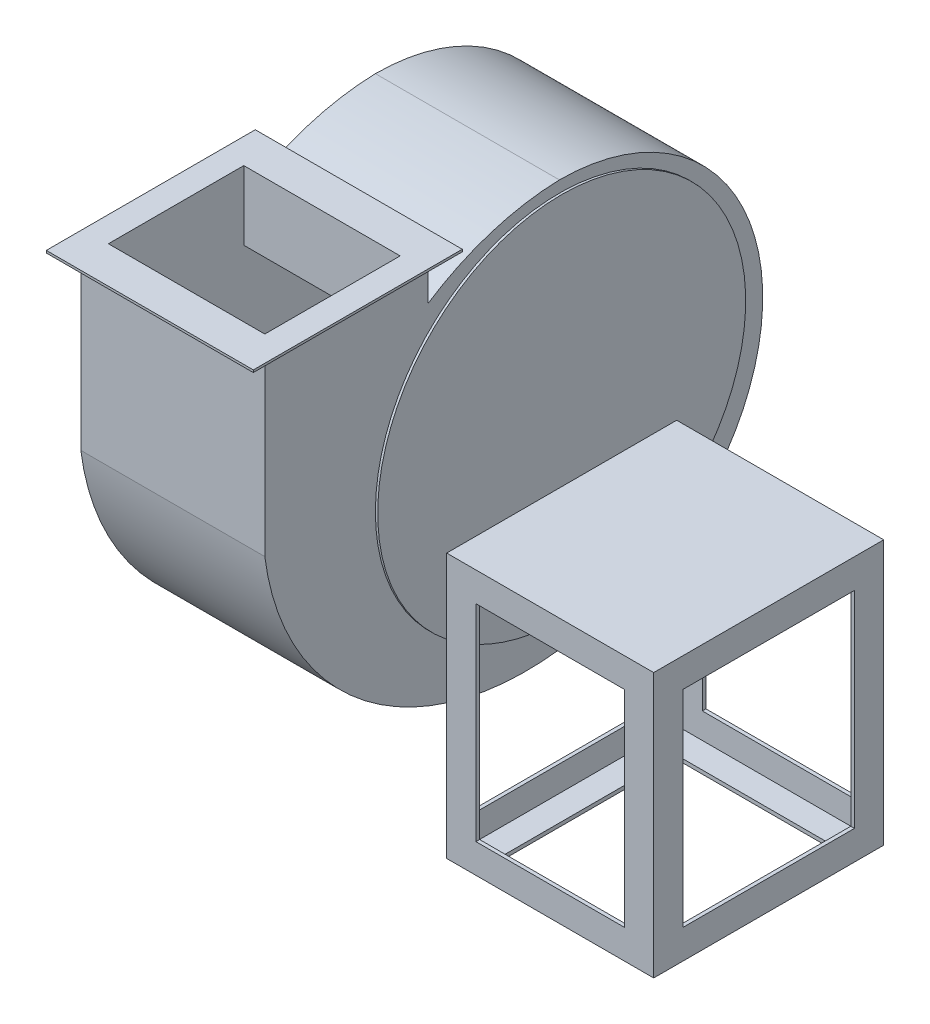
from build123d import *

# Parameters (mm, degrees)
SALIENTE_EXTRUIR1_DEPTH   = 230
SALIENTE_EXTRUIR1_2_DEPTH = 230
SALIENTE_EXTRUIR1_3_DEPTH = 230
SALIENTE_EXTRUIR1_4_DEPTH = 230
SALIENTE_EXTRUIR2_REACH   = 355.977
SALIENTE_EXTRUIR3_DEPTH   = 180
CROQUIS4_W                = 149.2
CROQUIS4_H                = 3.175
SALIENTE_EXTRUIR4_DEPTH   = 154.6
CROQUIS5_R                = 160
SALIENTE_EXTRUIR5_DEPTH   = 2
SALIENTE_EXTRUIR6_DEPTH   = 160
CROQUIS7_W                = 180
CROQUIS7_H                = 181.710341205
SALIENTE_EXTRUIR7_DEPTH   = 2
VACIADO1_START            = -150
VACIADO1_DEPTH            = 136
VACIADO1_START_2          = -14
VACIADO1_2_OUTLINE_R      = 148
VACIADO1_2_DEPTH          = 2
VACIADO1_START_3          = -12
VACIADO1_3_DEPTH          = 3.175
CROQUIS8_R                = 50
CORTAR_EXTRUIR1_DEPTH     = 14


# Read off the part's stored shape, not the designer's step: Vaciado1
with BuildPart() as part:
    # Croquis1 → Saliente-Extruir1 (new body)
    with BuildSketch(Plane(origin=(0, 0, 0), x_dir=(1, 0, 0), z_dir=(0, 1, 0))):
        Polygon((0, 0), (25.4, 0), (25.4, -3.175), (3.175, -3.175), (3.175, -25.4), (0, -25.4), align=None)
    extrude(amount=SALIENTE_EXTRUIR1_DEPTH)

    # Saliente-Extruir2: up to this face of the body (flat: up to its plane)
    saliente_extruir2_end = Plane(part.part.faces().sort_by_distance((12.7, 115, 0))[0])
    # Croquis2 → Saliente-Extruir2 (add, up to the picked face)
    with BuildSketch(Plane.XY.offset(200), mode=Mode.PRIVATE) as saliente_extruir2_sk1:
        Polygon((25.4, 230), (0, 230), (0, 204.6), (3.175, 204.6), (3.175, 226.825), (25.4, 226.825), align=None)
    saliente_extruir2_tool1 = split(extrude(saliente_extruir2_sk1.sketch, amount=-SALIENTE_EXTRUIR2_REACH, mode=Mode.PRIVATE), bisect_by=saliente_extruir2_end, keep=Keep.BOTH, mode=Mode.PRIVATE)
    # Croquis2 → Saliente-Extruir2 (add, up to the picked face)
    with BuildSketch(Plane.XY.offset(200), mode=Mode.PRIVATE) as saliente_extruir2_sk2:
        Polygon((176.825, 204.6), (180, 204.6), (180, 230), (154.6, 230), (154.6, 226.825), (176.825, 226.825), align=None)
    saliente_extruir2_tool2 = split(extrude(saliente_extruir2_sk2.sketch, amount=-SALIENTE_EXTRUIR2_REACH, mode=Mode.PRIVATE), bisect_by=saliente_extruir2_end, keep=Keep.BOTH, mode=Mode.PRIVATE)
    # Croquis2 → Saliente-Extruir2 (add, up to the picked face)
    with BuildSketch(Plane.XY.offset(200), mode=Mode.PRIVATE) as saliente_extruir2_sk3:
        Polygon((154.6, 0), (180, 0), (180, 25.4), (176.825, 25.4), (176.825, 3.175), (154.6, 3.175), align=None)
    saliente_extruir2_tool3 = split(extrude(saliente_extruir2_sk3.sketch, amount=-SALIENTE_EXTRUIR2_REACH, mode=Mode.PRIVATE), bisect_by=saliente_extruir2_end, keep=Keep.BOTH, mode=Mode.PRIVATE)
    # Croquis2 → Saliente-Extruir2 (add, up to the picked face)
    with BuildSketch(Plane.XY.offset(200), mode=Mode.PRIVATE) as saliente_extruir2_sk4:
        Polygon((3.175, 25.4), (0, 25.4), (0, 0), (25.4, 0), (25.4, 3.175), (3.175, 3.175), align=None)
    saliente_extruir2_tool4 = split(extrude(saliente_extruir2_sk4.sketch, amount=-SALIENTE_EXTRUIR2_REACH, mode=Mode.PRIVATE), bisect_by=saliente_extruir2_end, keep=Keep.BOTH, mode=Mode.PRIVATE)


with BuildPart() as body_2:
    # Croquis1 → Saliente-Extruir1 2 (new body)
    with BuildSketch(Plane(origin=(0, 0, 0), x_dir=(1, 0, 0), z_dir=(0, 1, 0))):
        Polygon((176.825, -25.4), (180, -25.4), (180, 0), (154.6, 0), (154.6, -3.175), (176.825, -3.175), align=None)
    extrude(amount=SALIENTE_EXTRUIR1_2_DEPTH)


with BuildPart() as body_3:
    # Croquis1 → Saliente-Extruir1 3 (new body)
    with BuildSketch(Plane(origin=(0, 0, 0), x_dir=(1, 0, 0), z_dir=(0, 1, 0))):
        Polygon((180, -200), (154.6, -200), (154.6, -196.825), (176.825, -196.825), (176.825, -174.6), (180, -174.6), align=None)
    extrude(amount=SALIENTE_EXTRUIR1_3_DEPTH)


with BuildPart() as body_4:
    # Croquis1 → Saliente-Extruir1 4 (new body)
    with BuildSketch(Plane(origin=(0, 0, 0), x_dir=(1, 0, 0), z_dir=(0, 1, 0))):
        Polygon((3.175, -174.6), (0, -174.6), (0, -200), (25.4, -200), (25.4, -196.825), (3.175, -196.825), align=None)
    extrude(amount=SALIENTE_EXTRUIR1_4_DEPTH)


with BuildPart() as part_1:
    add(part.part)

    add(body_2.part)  # Saliente-Extruir2 merges body 2

    add(body_3.part)  # Saliente-Extruir2 merges body 3

    add(body_4.part)  # Saliente-Extruir2 merges body 4
    add(saliente_extruir2_tool1.solids().sort_by(Axis((12.7, 229.64079, 200), (0, 0, -1)))[0])
    add(saliente_extruir2_tool2.solids().sort_by(Axis((178.4125, 204.95921, 200), (0, 0, -1)))[0])
    add(saliente_extruir2_tool3.solids().sort_by(Axis((167.3, 0.35921, 200), (0, 0, -1)))[0])
    add(saliente_extruir2_tool4.solids().sort_by(Axis((1.5875, 25.04079, 200), (0, 0, -1)))[0])

    # Croquis3 → Saliente-Extruir3 (add)
    with BuildSketch(Plane.ZY):
        Polygon((0, 0), (25.4, 0), (25.4, 3.175), (3.175, 3.175), (3.175, 25.4), (0, 25.4), align=None)
        Polygon((196.825, 25.4), (200, 25.4), (200, 0), (174.6, 0), (174.6, 3.175), (196.825, 3.175), align=None)
        Polygon((200, 230), (174.6, 230), (174.6, 226.825), (196.825, 226.825), (196.825, 204.6), (200, 204.6), align=None)
        Polygon((3.175, 204.6), (0, 204.6), (0, 230), (25.4, 230), (25.4, 226.825), (3.175, 226.825), align=None)
    extrude(amount=-SALIENTE_EXTRUIR3_DEPTH)

    # Croquis4 → Saliente-Extruir4 (add)
    with BuildSketch(Plane(origin=(180, 0, 0), x_dir=(0, 0, -1), z_dir=(1, 0, 0))):
        with Locations((-100, 228.4125)):
            Rectangle(CROQUIS4_W, CROQUIS4_H)
    extrude(amount=-SALIENTE_EXTRUIR4_DEPTH)

    # Croquis5 → Saliente-Extruir5 (add)
    with BuildSketch(Plane.ZY):
        with Locations(Location((100, 290, 0), (0, 0, 231.317812547))):
            Circle(CROQUIS5_R)
    extrude(amount=SALIENTE_EXTRUIR5_DEPTH)

    # Croquis6 → Saliente-Extruir6 (add)
    with BuildSketch(Plane.ZY.offset(2)):
        with BuildLine():
            Line((356.150943647, 460), (214.440602442, 460))
            Line((214.440602442, 460), (214.440602442, 423.899354359))
            ThreePointArc((214.440602442, 423.899354359), (159.743155313, 449.947233376), (100, 460))
            ThreePointArc((100, 460), (-76.81003198, 283.18996802), (100, 106.379936039))
            ThreePointArc((100, 106.379936039), (269.093013095, 152.354443037), (356.150943647, 304.430144907))
            Line((356.150943647, 304.430144907), (356.150943647, 460))
        make_face()
    extrude(amount=SALIENTE_EXTRUIR6_DEPTH)

    # Croquis7 → Saliente-Extruir7 (add)
    with BuildSketch(Plane(origin=(0, 460, 0), x_dir=(1, 0, 0), z_dir=(0, 1, 0))):
        with Locations((-82, -285.295773045)):
            Rectangle(CROQUIS7_W, CROQUIS7_H)
    extrude(amount=-SALIENTE_EXTRUIR7_DEPTH)

    # Vaciado1 outline → Vaciado1 (cut)
    with BuildSketch(Plane.YZ.offset(VACIADO1_START)):
        with BuildLine():
            Line((460, 344.150943647), (305.204872044, 344.150943647))
            ThreePointArc((305.204872044, 344.150943647), (161.38343221, 261.150196169), (118.381694611, 100.761352414))
            ThreePointArc((118.381694611, 100.761352414), (282.726065317, -64.809379089), (447.999915945, 99.833548521))
            ThreePointArc((447.999915945, 99.833548521), (434.67491503, 167.171792789), (400.045404599, 226.440602442))
            Line((400.045404599, 226.440602442), (460, 226.440602442))
            Line((460, 226.440602442), (460, 344.150943647))
        make_face()
    extrude(amount=VACIADO1_DEPTH, mode=Mode.SUBTRACT)

    # Vaciado1 2 outline → Vaciado1 2 (cut)
    with BuildSketch(Plane.YZ.offset(VACIADO1_START_2)):
        with Locations((290, 100)):
            Circle(VACIADO1_2_OUTLINE_R)
    extrude(amount=VACIADO1_2_DEPTH, mode=Mode.SUBTRACT)

    # Vaciado1 3 outline → Vaciado1 3 (cut)
    with BuildSketch(Plane.YZ.offset(VACIADO1_START_3)):
        with BuildLine():
            Line((169.981501426, 186.6), (216.6, 186.6))
            Line((216.6, 186.6), (216.6, 13.4))
            Line((216.6, 13.4), (169.981501426, 13.4))
            ThreePointArc((169.981501426, 13.4), (170.490801521, 12.698502424), (171.004201755, 12))
            Line((171.004201755, 12), (218, 12))
            Line((218, 12), (218, 188))
            Line((218, 188), (171.004201755, 188))
            ThreePointArc((171.004201755, 188), (170.490801521, 187.301497576), (169.981501426, 186.6))
        make_face()
    extrude(amount=VACIADO1_3_DEPTH, mode=Mode.SUBTRACT)

    # Croquis8 → Cortar-Extruir1 (cut)
    with BuildSketch(Plane.ZY.offset(162)):
        with Locations((100, 290)):
            Circle(CROQUIS8_R)
    extrude(amount=-CORTAR_EXTRUIR1_DEPTH, mode=Mode.SUBTRACT)


solid = part_1.part
